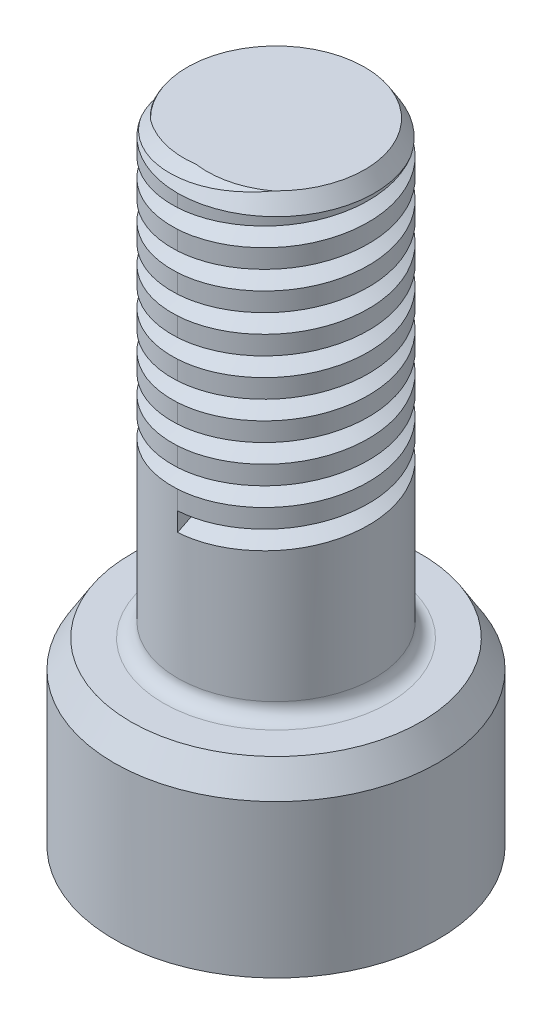
from build123d import *

# Parameters (mm, degrees)
CUT_SWEEP1_PITCH   = 0.793751588
CUT_EXTRUDE1_DEPTH = 1.955803912
FILLET1_R          = 0.30480061
FILLET2_R          = 0.396875794
CHAMFER3_SIZE      = 0.127


with BuildPart() as part:
    # Sketch1 → Revolve1 (revolve)
    with BuildSketch(Plane.XY, mode=Mode.PRIVATE) as revolve1_sk:
        Polygon((0, 0), (0, 13.690608331), (2.082804166, 13.690608331), (2.082804166, 4.165608331), (3.429006858, 4.165608331), (3.429006858, 0), align=None)
    revolve(revolve1_sk.sketch.rotate(Axis((0, 0, 0), (0, 1, 0)), 90), axis=Axis((0, 0, 0), (0, 1, 0)))

    # Cut-Sweep1: arcs per turn and ends read off the stored shape
    # Cut-Sweep1: the profile of Sketch3 profile screwed along a right-hand helix through 9 turns, 8 arcs to a turn; built about Z, then put on its axis
    cut_sweep1_z = Axis((0, 0, 0), (0, 0, 1))
    cut_sweep1_corners = [(2.083104166, 0, -0.595163691), (2.083104166, 0, -0.992339484), (1.685928372, 0, -0.793751588)]
    with BuildLine(mode=Mode.PRIVATE) as cut_sweep1_profile:
        Line(cut_sweep1_corners[0], cut_sweep1_corners[1])
        Line(cut_sweep1_corners[1], cut_sweep1_corners[2])
        Line(cut_sweep1_corners[2], cut_sweep1_corners[0])
    cut_sweep1_cap = Face(cut_sweep1_profile.wire())
    cut_sweep1_turn_angles = [0, 22.5, 45, 67.5, 90, 112.5, 135, 157.5, 180, 202.5, 225, 247.5, 270, 292.5, 315, 337.5, 360]
    cut_sweep1_turn_weights = [1, 0.9238795325112867, 1, 0.9238795325112867, 1, 0.9238795325112867, 1, 0.9238795325112867, 1, 0.9238795325112867, 1, 0.9238795325112867, 1, 0.9238795325112867, 1, 0.9238795325112867, 1]
    cut_sweep1_turn_rails = [Edge.make_bspline([Vector(p[0], p[1], 0).rotate(cut_sweep1_z, cut_sweep1_turn_angles[k]) / cut_sweep1_turn_weights[k] + Vector(0, 0, p[2] + CUT_SWEEP1_PITCH * cut_sweep1_turn_angles[k] / 360) for k in range(17)], [0, 0, 0, 1, 1, 2, 2, 3, 3, 4, 4, 5, 5, 6, 6, 7, 7, 8, 8, 8], 2, cut_sweep1_turn_weights) for p in cut_sweep1_corners]
    cut_sweep1_turn_sides = [Face.make_surface_from_curves(cut_sweep1_turn_rails[p[0]], cut_sweep1_turn_rails[p[1]]) for p in [(0, 1), (1, 2), (2, 0)]]
    cut_sweep1 = Plane(origin=(0, 13.690608331, 0), x_dir=(0, 0, 1), z_dir=(0, -1, 0)) * Solid(Shell([*[p.moved(Location((0, 0, CUT_SWEEP1_PITCH * i))) for i in range(9) for p in cut_sweep1_turn_sides], cut_sweep1_cap, cut_sweep1_cap.rotate(cut_sweep1_z, 3240).moved(Location((0, 0, CUT_SWEEP1_PITCH * 3240 / 360)))]))
    add(cut_sweep1, mode=Mode.SUBTRACT)

    # Sketch4 → Cut-Extrude1 (cut)
    with BuildSketch(Plane(origin=(0, 0, 0), x_dir=(1, 0, 0), z_dir=(0, 1, 0))):
        Polygon((0, 2.06772639), (-1.790703581, 1.033863195), (-1.790703581, -1.033863195), (0, -2.06772639), (1.790703581, -1.033863195), (1.790703581, 1.033863195), align=None)
    extrude(amount=CUT_EXTRUDE1_DEPTH, mode=Mode.SUBTRACT)

    # Fillet1
    fillet1_edges = [part.edges().sort_by_distance(p)[0] for p in [
        (0, 4.165608331, 2.082804166),
    ]]
    fillet(fillet1_edges, radius=FILLET1_R)

    # Fillet2
    fillet2_edges = [part.edges().sort_by_distance(p)[0] for p in [
        (1.790703581, 0.977901956, -1.033863195),
        (0, 0.977901956, -2.06772639),
        (-1.790703581, 0.977901956, -1.033863195),
        (-1.790703581, 0.977901956, 1.033863195),
        (0, 0.977901956, 2.06772639),
        (1.790703581, 0.977901956, 1.033863195),
        (0.895351791, 1.955803912, -1.550794792),
        (-0.895351791, 1.955803912, -1.550794792),
        (-1.790703581, 1.955803912, 0),
        (-0.895351791, 1.955803912, 1.550794792),
        (0.895351791, 1.955803912, 1.550794792),
        (1.790703581, 1.955803912, 0),
    ]]
    fillet(fillet2_edges, radius=FILLET2_R)

    # Chamfer1: read off the stored shape, not the designer's step
    # Chamfer1 outline → Chamfer1 (revolve, cut)
    with BuildSketch(Plane.XY):
        Polygon((2.082804166, 13.690608331), (1.879603759, 13.690608331), (2.082804166, 13.361469354), align=None)
    revolve(axis=Axis((0, 0, 0), (0, 1, 0)), mode=Mode.SUBTRACT)

    # Chamfer2: read off the stored shape, not the designer's step
    # Chamfer2 outline → Chamfer2 (revolve, cut)
    with BuildSketch(Plane.XY):
        Polygon((2.853013648, 0), (3.429006858, 0), (3.429006858, 0.355600711), align=None)
        Polygon((3.073406147, 4.165608331), (3.429006858, 3.589615121), (3.429006858, 4.165608331), align=None)
    revolve(axis=Axis((0, 0, 0), (0, 1, 0)), mode=Mode.SUBTRACT)

    # Chamfer3
    chamfer3_edges = [part.edges().sort_by_distance(p)[0] for p in [
        (0.895351791, 0, -1.550794792),
        (-0.895351791, 0, -1.550794792),
        (-1.790703581, 0, 0),
        (-0.895351791, 0, 1.550794792),
        (0.895351791, 0, 1.550794792),
        (1.790703581, 0, 0),
        (0, 0, -2.006329491),
        (1.737532307, 0, -1.003164745),
        (1.737532307, 0, 1.003164745),
        (0, 0, 2.006329491),
        (-1.737532307, 0, 1.003164745),
        (-1.737532307, 0, -1.003164745),
    ]]
    chamfer(chamfer3_edges, length=CHAMFER3_SIZE)


solid = part.part
